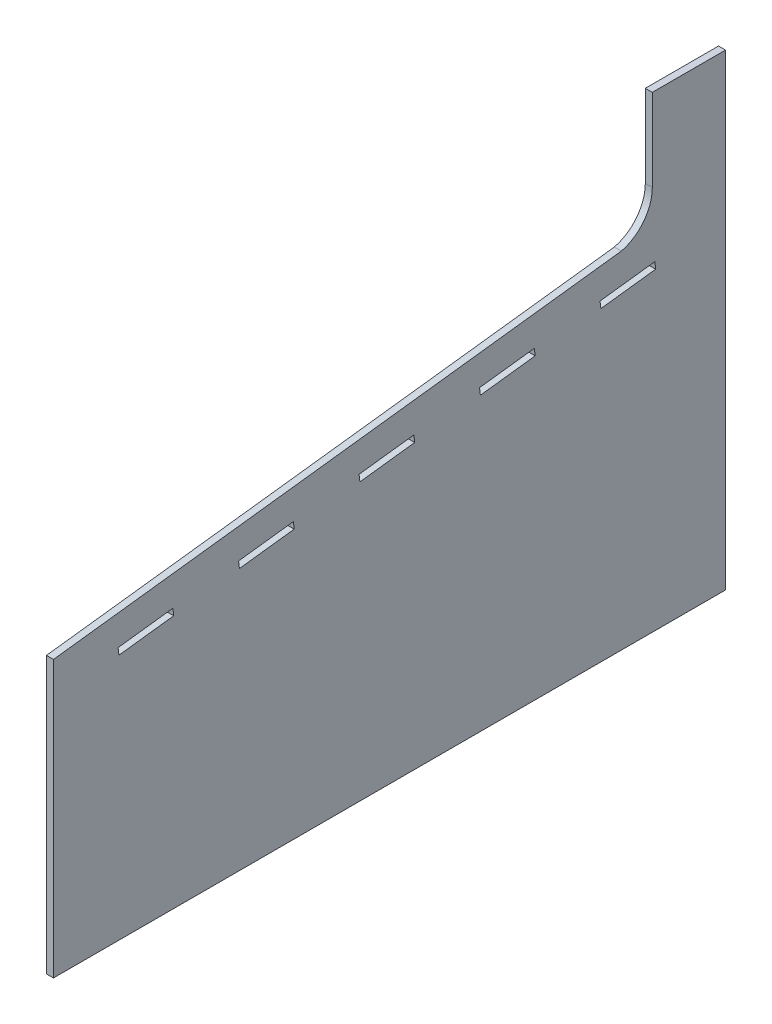
from build123d import *

# Parameters (mm, degrees)
BOSS_EXTRUDE1_DEPTH = 6.35
CUT_EXTRUDE1_DEPTH  = 6.35


with BuildPart() as part:
    # Sketch1 → Boss-Extrude1 (new body)
    with BuildSketch(Plane(origin=(0, 0, 0), x_dir=(0, 0, -1), z_dir=(1, 0, 0))):
        with BuildLine():
            Line((0, 250), (514.569488044, 313.181188643))
            ThreePointArc((514.569488044, 313.181188643), (534.796363904, 326.297688332), (542.65, 349.09))
            Line((542.65, 349.09), (542.65, 423.72))
            Line((542.65, 423.72), (609, 423.72))
            Line((609, 423.72), (609, 250))
            Line((609, 250), (609, 0))
            Line((609, 0), (0, 0))
            Line((0, 0), (0, 250))
        make_face()
    extrude(amount=BOSS_EXTRUDE1_DEPTH)

    # Sketch2 → Cut-Extrude1 (cut)
    with BuildSketch(Plane(origin=(6.35, 0, 0), x_dir=(0, 0, -1), z_dir=(1, 0, 0))):
        Polygon((58.560222947, 229.987525974), (59.334093277, 223.684857911), (108.96140086, 229.778325081), (108.187530529, 236.080993144), align=None)
        Polygon((217.367607209, 249.486620918), (167.740299627, 243.393153748), (168.514169958, 237.090485685), (218.14147754, 243.183952855), align=None)
        Polygon((326.54768389, 262.892248693), (276.920376308, 256.798781523), (277.694246639, 250.49611346), (327.321554221, 256.58958063), align=None)
        Polygon((435.727760571, 276.297876467), (386.100452988, 270.204409297), (386.874323319, 263.901741234), (436.501630901, 269.995208405), align=None)
        Polygon((544.907837251, 289.703504242), (495.280529669, 283.610037072), (496.0544, 277.307369009), (545.681707582, 283.400836179), align=None)
    extrude(amount=-CUT_EXTRUDE1_DEPTH, mode=Mode.SUBTRACT)


solid = part.part
